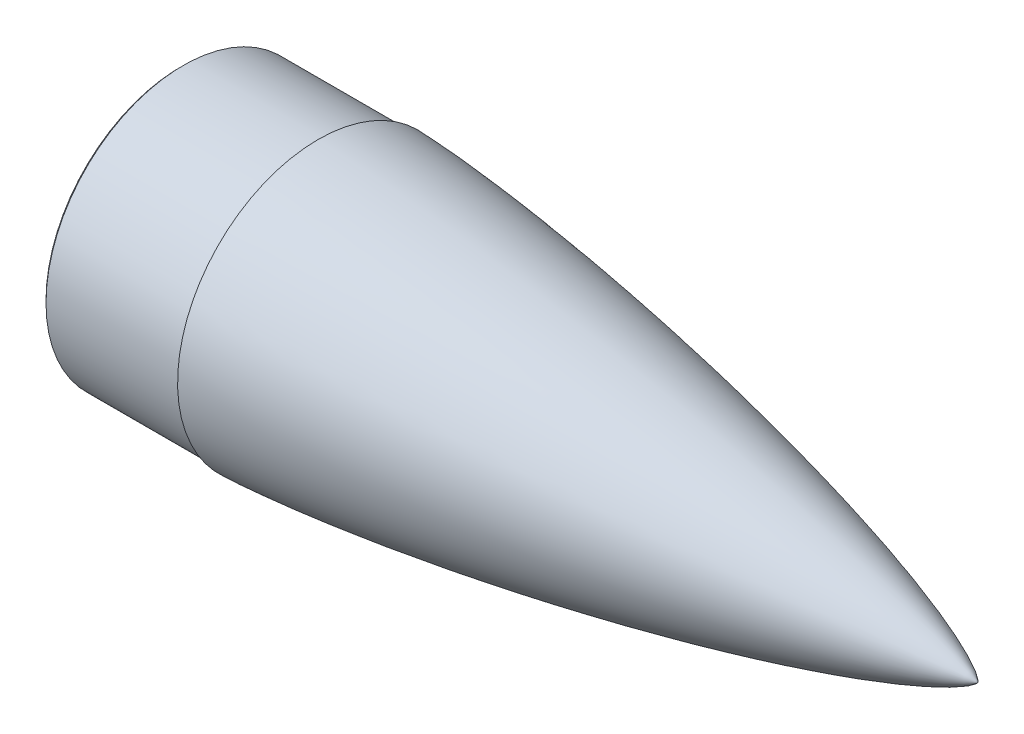
from build123d import *

# Parameters (mm, degrees)
CHAMFER1_SIZE            = 1.5
BOSS_EXTRUDE6_DEPTH      = 7.5
BOSS_EXTRUDE6_DEPTH_BACK = 7.5
SKETCH11_R               = 2.5


with BuildPart() as part:
    # Sketch10 → Revolve1 (revolve)
    with BuildSketch(Plane.XY):
        with BuildLine():
            Line((11.112493743, 81.99983), (11.112493743, 67.49983))
            Line((11.112493743, 67.49983), (129.304508698, 67.49983))
            add(Edge.make_bspline(
                [(368.967251823, 0), (368.965299543, 0.012338489), (368.959416882, 0.036518378), (368.940636147, 0.082964007), (368.902304552, 0.158736421), (368.845538097, 0.250270687), (368.755690124, 0.376555746), (368.616653262, 0.54835284), (368.392888737, 0.793577299), (368.008659121, 1.164904965), (367.344738263, 1.729853685), (366.176060796, 2.601559154), (364.09282389, 3.960032328), (360.425978756, 6.040734396), (354.402196649, 9.01831007), (344.042994901, 13.507695011), (329.152005398, 19.128483965), (310.425167902, 25.398569259), (288.741266406, 31.933693508), (266.378532845, 38.106125474), (243.901379123, 43.846895186), (221.331994001, 49.212017941), (198.683967629, 54.234500927), (175.966897581, 58.934255644), (156.034567874, 62.771715365), (141.509051931, 65.395628269), (132.679425236, 66.924517444), (129.562757302, 67.455859883), (129.304508698, 67.49983)],
                knots=[0, 0, 0, 0, 0, 0.000134949, 0.000269899, 0.000539798, 0.000919537, 0.001299277, 0.001947431, 0.00293136, 0.004511869, 0.007081312, 0.011380263, 0.018707867, 0.031423867, 0.052705479, 0.084103008, 0.140910136, 0.203703492, 0.266497064, 0.329290816, 0.392084375, 0.454877964, 0.517671564, 0.580465191, 0.643258828, 0.674655593, 0.677492072, 0.677492072, 0.677492072, 0.677492072, 0.677492072], degree=4))
            Line((368.967251823, 0), (408.967251823, 0))
            add(Edge.make_bspline(
                [(408.967251823, 0), (408.964913524, 0.013501739), (408.958040758, 0.039916077), (408.936520441, 0.090485698), (408.892222076, 0.174057132), (408.826281575, 0.275556803), (408.721696416, 0.415833756), (408.561101809, 0.605075245), (408.30561918, 0.87242415), (407.86966713, 1.275299562), (407.120955138, 1.885142115), (405.803773451, 2.82590185), (403.46240692, 4.287152794), (399.325294488, 6.531818454), (392.481146888, 9.758904649), (380.662076725, 14.628008466), (363.637187185, 20.711720382), (342.215241093, 27.476512989), (317.428462321, 34.49762647), (291.879335737, 41.10482439), (266.21046092, 47.228993169), (240.44548836, 52.933436777), (214.598861982, 58.255439009), (188.68089566, 63.217582693), (165.946174917, 67.253280679), (146.421982586, 70.493799722), (130.127893898, 73.044947468), (117.078590637, 74.994157933), (104.015464216, 76.84854079), (92.573263959, 78.384492045), (82.757139441, 79.635603973), (74.571340184, 80.632219902), (68.019260454, 81.400804211), (61.463723364, 82.139375899), (54.90469802, 82.84637726), (48.342159918, 83.519940506), (41.776057559, 84.15778717), (36.02754108, 84.682157239), (31.097921259, 85.105234912), (26.988317923, 85.438669825), (23.699666618, 85.693218594), (20.085807822, 85.958448038), (16.719873821, 86.189018485), (13.602098287, 86.386966779), (10.732704013, 86.554575744), (8.436635008, 86.678703291), (6.139997341, 86.792157585), (4.129892063, 86.879313264), (2.40653858, 86.944618982), (1.257348635, 86.979022496), (0.68269791, 86.99491462), (0.395312527, 86.99983)],
                knots=[0, 0, 0, 0, 0, 0.000130123, 0.000260245, 0.000520491, 0.000900391, 0.00128029, 0.001925099, 0.002881508, 0.004418208, 0.006927086, 0.011110697, 0.018279138, 0.03067276, 0.051704469, 0.08310228, 0.139908797, 0.202702513, 0.265496165, 0.328289682, 0.391083359, 0.453876973, 0.516670577, 0.579464197, 0.642257765, 0.673654596, 0.705051427, 0.736448267, 0.767845106, 0.799241874, 0.814940257, 0.830638641, 0.846337073, 0.862035505, 0.877733936, 0.893432368, 0.90913072, 0.924829072, 0.932678248, 0.940527424, 0.9483766, 0.956225776, 0.967169332, 0.97264111, 0.978112888, 0.983584666, 0.989056444, 0.994528222, 0.997264111, 1, 1, 1, 1, 1], degree=4))
            Line((0.395312527, 86.99983), (0.395312527, 84.99983))
            Line((0.395312527, 84.99983), (-84.604517473, 84.99983))
            Line((-84.604517473, 84.99983), (-84.604517473, 81.99983))
            Line((-84.604517473, 81.99983), (11.112493743, 81.99983))
        make_face()
    revolve(axis=Axis((46.917858469, 0, 0), (-1, 0, 0)))

    # Chamfer1
    chamfer1_edges = [part.edges().sort_by_distance(p)[0] for p in [
        (-84.604517473, -84.99983, 0),
    ]]
    chamfer(chamfer1_edges, length=CHAMFER1_SIZE)

    # Sketch11 → Boss-Extrude6 (add, two sides: drawn at the far end of the back side and taken through both)
    # profile 1 of 4: a face of its own
    with BuildSketch(Plane(origin=(70, 0, 0), x_dir=(0, 0, -1), z_dir=(1, 0, 0)).offset(-BOSS_EXTRUDE6_DEPTH_BACK)):
        with BuildLine():
            Line((39.645757239, 13.018375058), (39.645757239, -13.018375058))
            Line((39.645757239, -13.018375058), (66.232710279, -13.018375058))
            ThreePointArc((66.232710279, -13.018375058), (67.5, 0), (66.232710279, 13.018375058))
            Line((66.232710279, 13.018375058), (39.645757239, 13.018375058))
        make_face()
        with Locations((52.145757239, 0)):
            Circle(SKETCH11_R, mode=Mode.SUBTRACT)
    # profile 2 of 4: a face of its own
    with BuildSketch(Plane(origin=(70, 0, 0), x_dir=(0, 0, -1), z_dir=(1, 0, 0)).offset(-BOSS_EXTRUDE6_DEPTH_BACK)):
        with BuildLine():
            ThreePointArc((-13.018375058, -66.232710279), (0, -67.5), (13.018375058, -66.232710279))
            Line((13.018375058, -66.232710279), (13.018375058, -39.645757239))
            Line((13.018375058, -39.645757239), (-13.018375058, -39.645757239))
            Line((-13.018375058, -39.645757239), (-13.018375058, -66.232710279))
        make_face()
        with Locations((0, -52.145757239)):
            Circle(SKETCH11_R, mode=Mode.SUBTRACT)
    # profile 3 of 4: a face of its own
    with BuildSketch(Plane(origin=(70, 0, 0), x_dir=(0, 0, -1), z_dir=(1, 0, 0)).offset(-BOSS_EXTRUDE6_DEPTH_BACK)):
        with BuildLine():
            Line((13.018375058, 39.645757239), (13.018375058, 66.232710279))
            ThreePointArc((13.018375058, 66.232710279), (0, 67.5), (-13.018375058, 66.232710279))
            Line((-13.018375058, 66.232710279), (-13.018375058, 39.645757239))
            Line((-13.018375058, 39.645757239), (13.018375058, 39.645757239))
        make_face()
        with Locations((0, 52.145757239)):
            Circle(SKETCH11_R, mode=Mode.SUBTRACT)
    # profile 4 of 4: a face of its own
    with BuildSketch(Plane(origin=(70, 0, 0), x_dir=(0, 0, -1), z_dir=(1, 0, 0)).offset(-BOSS_EXTRUDE6_DEPTH_BACK)):
        with BuildLine():
            ThreePointArc((-66.232710279, 13.018375058), (-67.5, 0), (-66.232710279, -13.018375058))
            Line((-66.232710279, -13.018375058), (-39.645757239, -13.018375058))
            Line((-39.645757239, -13.018375058), (-39.645757239, 13.018375058))
            Line((-39.645757239, 13.018375058), (-66.232710279, 13.018375058))
        make_face()
        with Locations((-52.145757239, 0)):
            Circle(SKETCH11_R, mode=Mode.SUBTRACT)
    extrude(amount=BOSS_EXTRUDE6_DEPTH + BOSS_EXTRUDE6_DEPTH_BACK)


solid = part.part
